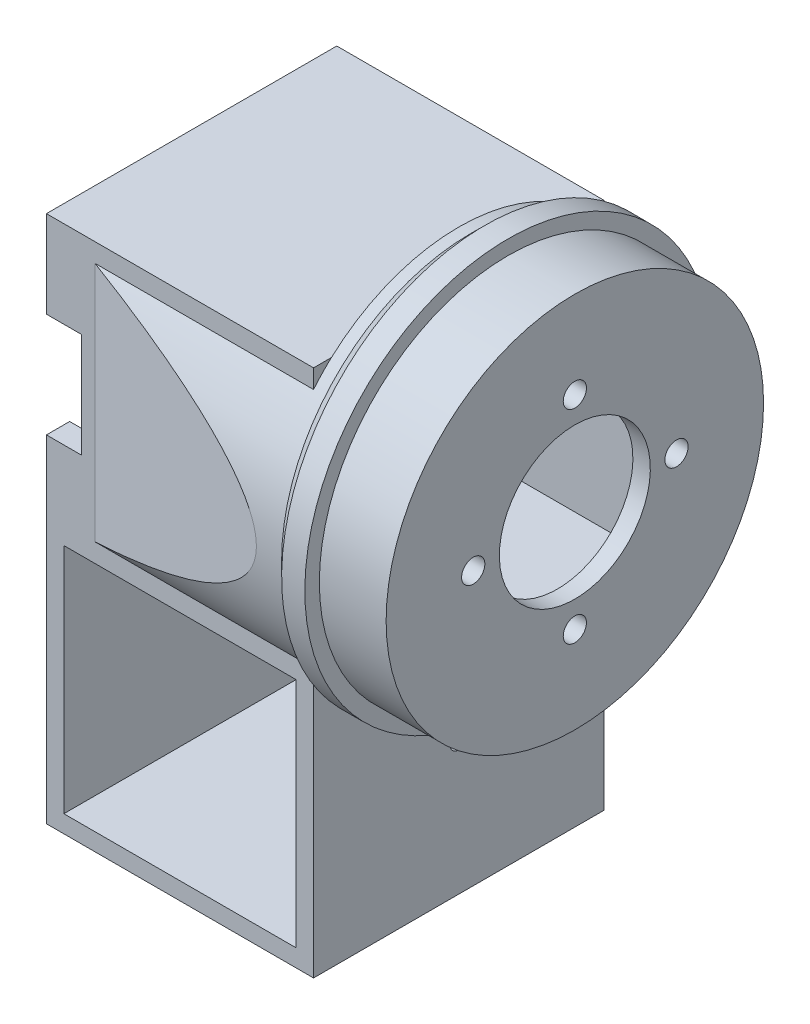
from build123d import *

# Parameters (mm, degrees)
ESQUISSE1_W             = 46
ESQUISSE1_H             = 46
ESQUISSE1_W_2           = 40
ESQUISSE1_H_2           = 40
BOSS_EXTRU_1_DEPTH      = 50
ESQUISSE2_W             = 50
ESQUISSE2_H             = 48
ESQUISSE2_W_2           = 42
ESQUISSE2_H_2           = 42
BOSS_EXTRU_2_DEPTH      = 46
ESQUISSE4_W             = 6
ESQUISSE4_H             = 18
ENL_V_MAT_EXTRU_1_DEPTH = 6
ESQUISSE5_R             = 32.5
ESQUISSE5_W             = 42
ESQUISSE5_H             = 42
BOSS_EXTRU_3_DEPTH      = 17
ESQUISSE6_R             = 32.5
ESQUISSE6_R_2           = 2
ESQUISSE6_R_3           = 13
BOSS_EXTRU_4_DEPTH      = 3
CHANFREIN1_SIZE         = 37.637040876
CHANFREIN1_SIZE_2       = 8
BOSS_EXTRU_5_START      = -5
ESQUISSE7_R             = 35
ESQUISSE7_R_2           = 32.5
BOSS_EXTRU_5_DEPTH      = 3.5
CHANFREIN2_SIZE         = 3
ESQUISSE8_R             = 1.5
ENL_V_MAT_EXTRU_2_DEPTH = 136.499077488
ESQUISSE9_R             = 1.5
ENL_V_MAT_EXTRU_3_DEPTH = 13.5


with BuildPart() as part:
    # Esquisse1 → Boss.-Extru.1 (new body)
    with BuildSketch(Plane.XY):
        with Locations((-23, 23)):
            Rectangle(ESQUISSE1_W, ESQUISSE1_H)
        with Locations((-23, 23)):
            Rectangle(ESQUISSE1_W_2, ESQUISSE1_H_2, mode=Mode.SUBTRACT)
    extrude(amount=BOSS_EXTRU_1_DEPTH)

    # Esquisse2 → Boss.-Extru.2 (add)
    with BuildSketch(Plane(origin=(0, 0, 0), x_dir=(0, 0, -1), z_dir=(1, 0, 0))):
        with Locations((-25, 67)):
            Rectangle(ESQUISSE2_W, ESQUISSE2_H)
        with Locations((-25, 67)):
            Rectangle(ESQUISSE2_W_2, ESQUISSE2_H_2, mode=Mode.SUBTRACT)
    extrude(amount=-BOSS_EXTRU_2_DEPTH)

    # Esquisse4 → Enlèv. mat.-Extru.1 (cut)
    with BuildSketch(Plane.XY.offset(50)):
        with Locations((-43, 67)):
            Rectangle(ESQUISSE4_W, ESQUISSE4_H)
    extrude(amount=-ENL_V_MAT_EXTRU_1_DEPTH, mode=Mode.SUBTRACT)

    # Esquisse5 → Boss.-Extru.3 (add)
    with BuildSketch(Plane(origin=(0, 0, 0), x_dir=(0, 0, -1), z_dir=(1, 0, 0))):
        with Locations(Location((-25, 67, 0), (0, 0, 219.715137232))):
            Circle(ESQUISSE5_R)
        with Locations((-25, 67)):
            Rectangle(ESQUISSE5_W, ESQUISSE5_H, mode=Mode.SUBTRACT)
    extrude(amount=BOSS_EXTRU_3_DEPTH)

    # Esquisse6 → Boss.-Extru.4 (add)
    with BuildSketch(Plane(origin=(17, 0, 0), x_dir=(0, 0, -1), z_dir=(1, 0, 0))):
        with Locations(Location((-25, 67, 0), (0, 0, 219.715137232))):
            Circle(ESQUISSE6_R)
        with Locations(Location((-25, 84.5, 0), (0, 0, 90))):
            Circle(ESQUISSE6_R_2, mode=Mode.SUBTRACT)
        with Locations(Location((-7.5, 67, 0), (0, 0, 90))):
            Circle(ESQUISSE6_R_2, mode=Mode.SUBTRACT)
        with Locations(Location((-25, 49.5, 0), (0, 0, 90))):
            Circle(ESQUISSE6_R_2, mode=Mode.SUBTRACT)
        with Locations(Location((-42.5, 67, 0), (0, 0, 90))):
            Circle(ESQUISSE6_R_2, mode=Mode.SUBTRACT)
        with Locations(Location((-25, 67, 0), (0, 0, 90))):
            Circle(ESQUISSE6_R_3, mode=Mode.SUBTRACT)
    extrude(amount=BOSS_EXTRU_4_DEPTH)

    # Chanfrein1
    # the kernel refuses this chamfer: 37.637040876, 8 mm, written as the material it adds along each edge
    with BuildSketch(Plane(origin=(0, 185.543751295, 50), x_dir=(-0.999967974892076, 0, -0.008003073799517018), z_dir=(0, -1, 0))) as chanfrein1_piece_1_section:
        Polygon((CHANFREIN1_SIZE * 0.999967974888, -CHANFREIN1_SIZE * 0.00800307379948), (-CHANFREIN1_SIZE_2 * 0.00800307379952, -CHANFREIN1_SIZE_2 * 0.999967974892), (0, 0), align=None)
    chanfrein1_piece_1 = extrude(amount=237.08750259, mode=Mode.PRIVATE)
    chanfrein1_piece_1 = chanfrein1_piece_1 & Plane(origin=(-15.292244733, 67, 25), x_dir=(0, -0.6389710663806465, 0.7692307692288313), z_dir=(-1, 0, 0)) * Cylinder(32.5, 625, mode=Mode.PRIVATE)
    add(chanfrein1_piece_1)
    with BuildSketch(Plane(origin=(0, 185.543751295, 0), x_dir=(-0.999967974892076, 0, 0.008003073799517044), z_dir=(0, -1, 0))) as chanfrein1_piece_2_section:
        Polygon((CHANFREIN1_SIZE * 0.999967974888, CHANFREIN1_SIZE * 0.00800307379948), (-CHANFREIN1_SIZE_2 * 0.00800307379952, CHANFREIN1_SIZE_2 * 0.999967974892), (0, 0), align=None)
    chanfrein1_piece_2 = extrude(amount=237.08750259, mode=Mode.PRIVATE)
    chanfrein1_piece_2 = chanfrein1_piece_2 & Plane(origin=(-15.292244734, 67, 25), x_dir=(0, -0.6389710663806465, 0.7692307692288313), z_dir=(-1, 0, 0)) * Cylinder(32.5, 625, mode=Mode.PRIVATE)
    add(chanfrein1_piece_2)

    # Esquisse7 → Boss.-Extru.5 (add)
    with BuildSketch(Plane.ZY.offset(BOSS_EXTRU_5_START)):
        with Locations(Location((25, 67, 0), (0, 0, 270))):
            Circle(ESQUISSE7_R)
        with Locations(Location((25, 67, 0), (0, 0, 270))):
            Circle(ESQUISSE7_R_2, mode=Mode.SUBTRACT)
    extrude(amount=-BOSS_EXTRU_5_DEPTH)

    # Chanfrein2
    # the kernel refuses this chamfer: 3 mm, written as the material it adds along each edge
    with BuildSketch(Plane(origin=(5, 67, 25), x_dir=(0, -0.6389710663806288, 0.7692307692288458), z_dir=(0, -0.7692307692288458, -0.6389710663806288))) as chanfrein2_piece_1_section:
        Polygon((32.5 + CHANFREIN2_SIZE, 0), (32.5, CHANFREIN2_SIZE), (32.5, 0), align=None)
    chanfrein2_piece_1 = revolve(axis=Axis((5, 67, 25), (-1, 0, 0)), mode=Mode.PRIVATE)
    chanfrein2_piece_1 = chanfrein2_piece_1 & Plane(origin=(3.278266852, 67, 25), x_dir=(0, -1, 0), z_dir=(-1, 0, 0)) * Cylinder(35, 142, mode=Mode.PRIVATE)
    add(chanfrein2_piece_1)

    # Esquisse8 → Enlèv. mat.-Extru.2 (cut, through all)
    with BuildSketch(Plane.ZY.offset(46)):
        with Locations(Location((25, 23, 0), (0, 0, 270))):
            Circle(ESQUISSE8_R)
    extrude(amount=-ENL_V_MAT_EXTRU_2_DEPTH, mode=Mode.SUBTRACT)

    # Esquisse9 → Enlèv. mat.-Extru.3 (cut)
    with BuildSketch(Plane.XZ):
        with Locations(Location((-23, 25, 0), (0, 0, 270))):
            Circle(ESQUISSE9_R)
    extrude(amount=-ENL_V_MAT_EXTRU_3_DEPTH, mode=Mode.SUBTRACT)


solid = part.part
